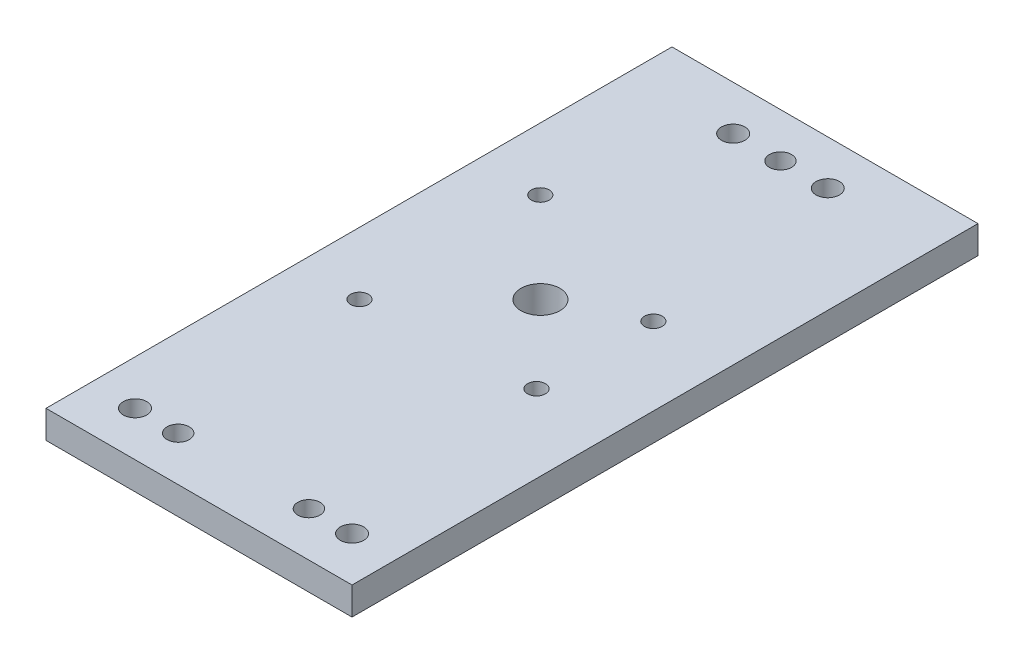
from build123d import *

# Parameters (mm, degrees)
SKETCH1_W             = 110
SKETCH1_H             = 225
BOSS_EXTRUDE1_DEPTH   = 10
M8_CLEARANCE_HOLE1_D  = 8.4
F_8_0MM_DOWEL_HOLE1_D = 8
CUT_EXTRUDE1_REACH    = 127.623
SKETCH8_R             = 7
M6_CLEARANCE_HOLE1_D  = 6.4


with BuildPart() as part:
    # Sketch1 → Boss-Extrude1 (new body)
    with BuildSketch(Plane(origin=(0, 0, 0), x_dir=(1, 0, 0), z_dir=(0, 1, 0))):
        Rectangle(SKETCH1_W, SKETCH1_H)
    extrude(amount=-BOSS_EXTRUDE1_DEPTH)

    # M8 Clearance Hole1 (through all)
    with Locations(Plane(origin=(0, 0, 0), x_dir=(1, 0, 0), z_dir=(0, 1, 0))):
        with Locations((-17, 96.5), (17, 96.5), (-39, -96.5), (39, -96.5)):
            Hole(M8_CLEARANCE_HOLE1_D / 2)

    # Ø8.0mm Dowel Hole1 (through all)
    with Locations(Plane(origin=(0, 0, 0), x_dir=(1, 0, 0), z_dir=(0, 1, 0))):
        with Locations((0, 96.5), (-23.5, -96.5), (23.5, -96.5)):
            Hole(F_8_0MM_DOWEL_HOLE1_D / 2)

    # Sketch8 → Cut-Extrude1 (cut, up to next)
    with BuildSketch(Plane(origin=(0, 0, 0), x_dir=(1, 0, 0), z_dir=(0, 1, 0)), mode=Mode.PRIVATE) as cut_extrude1_sk1:
        with Locations((0, 10.23)):
            Circle(SKETCH8_R)
    cut_extrude1_tool1 = extrude(cut_extrude1_sk1.sketch, amount=-CUT_EXTRUDE1_REACH, mode=Mode.PRIVATE) & part.part
    add(cut_extrude1_tool1.solids().sort_by_distance((0, 0, -10.23))[0], mode=Mode.SUBTRACT)

    # M6 Clearance Hole1 (through all)
    with Locations(Plane(origin=(0, 0, 0), x_dir=(1, 0, 0), z_dir=(0, 1, 0))):
        with Locations((27.065, 23.73), (27.065, -18.27), (-32.56, 42.73), (-32.56, -22.27)):
            Hole(M6_CLEARANCE_HOLE1_D / 2)


solid = part.part
